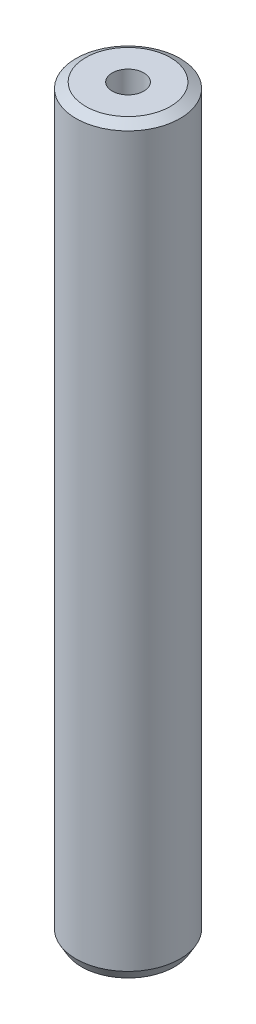
from build123d import *
from OCP.BRepFilletAPI import BRepFilletAPI_MakeChamfer

# Parameters (mm, degrees)
SKETCH1_R           = 15
BOSS_EXTRUDE1_DEPTH = 214.1382959
SKETCH2_R           = 4.560374865
CUT_EXTRUDE1_DEPTH  = 216.186453502
CHAMFER1_SIZE       = 1.613908585
CHAMFER1_SIZE2      = 2.795371669


with BuildPart() as part:
    # Sketch1 → Boss-Extrude1 (new body)
    with BuildSketch(Plane(origin=(0, 0, 0), x_dir=(1, 0, 0), z_dir=(0, 1, 0))):
        Circle(SKETCH1_R)
    extrude(amount=BOSS_EXTRUDE1_DEPTH)

    # Sketch2 → Cut-Extrude1 (cut, through all)
    with BuildSketch(Plane(origin=(0, 0, 0), x_dir=(1, 0, 0), z_dir=(0, 1, 0))):
        Circle(SKETCH2_R)
    extrude(amount=CUT_EXTRUDE1_DEPTH, mode=Mode.SUBTRACT)

    # Chamfer1: one chamfer whose edges measure the first distance from different faces: ONE call of the kernel's chamfer builder (chamfer() names one face for all edges)
    chamfer1_edges_1 = [part.edges().sort_by_distance(p)[0] for p in [
        (-15, 214.1382959, 0),
    ]]
    chamfer1_side_1 = [part.faces().sort_by_distance(p)[0] for p in [
        (-15, 107.06914795, 0),
    ]]
    chamfer1_edges_2 = [part.edges().sort_by_distance(p)[0] for p in [
        (-15, 0, 0),
    ]]
    chamfer1_side_2 = [part.faces().sort_by_distance(p)[0] for p in [
        (-14.575735931, 0, 0),
    ]]
    chamfer1 = BRepFilletAPI_MakeChamfer(part.part.solid().wrapped)
    for e in chamfer1_edges_1:
        chamfer1.Add(CHAMFER1_SIZE, CHAMFER1_SIZE2, e.wrapped, chamfer1_side_1[0].wrapped)  # the first distance lies on this face
    for e in chamfer1_edges_2:
        chamfer1.Add(CHAMFER1_SIZE, CHAMFER1_SIZE2, e.wrapped, chamfer1_side_2[0].wrapped)  # the first distance lies on this face
    add(Compound.cast(chamfer1.Shape()), mode=Mode.REPLACE)


solid = part.part
